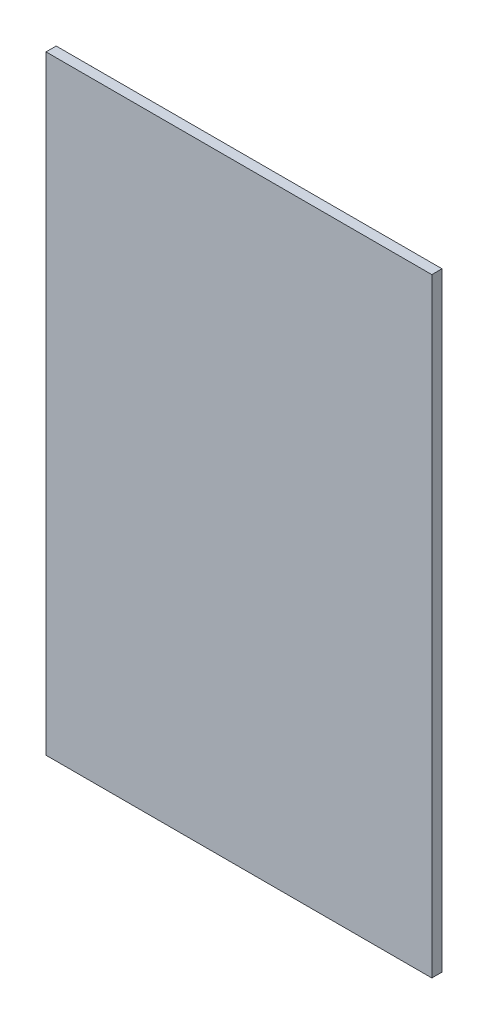
from build123d import *

# Parameters (mm, degrees)
ESQUISSE1_W        = 380
ESQUISSE1_H        = 600
BOSS_EXTRU_1_DEPTH = 10


with BuildPart() as part:
    # Esquisse1 → Boss.-Extru.1 (new body)
    with BuildSketch(Plane.XY):
        with Locations((-190, 300)):
            Rectangle(ESQUISSE1_W, ESQUISSE1_H)
    extrude(amount=-BOSS_EXTRU_1_DEPTH)


solid = part.part
